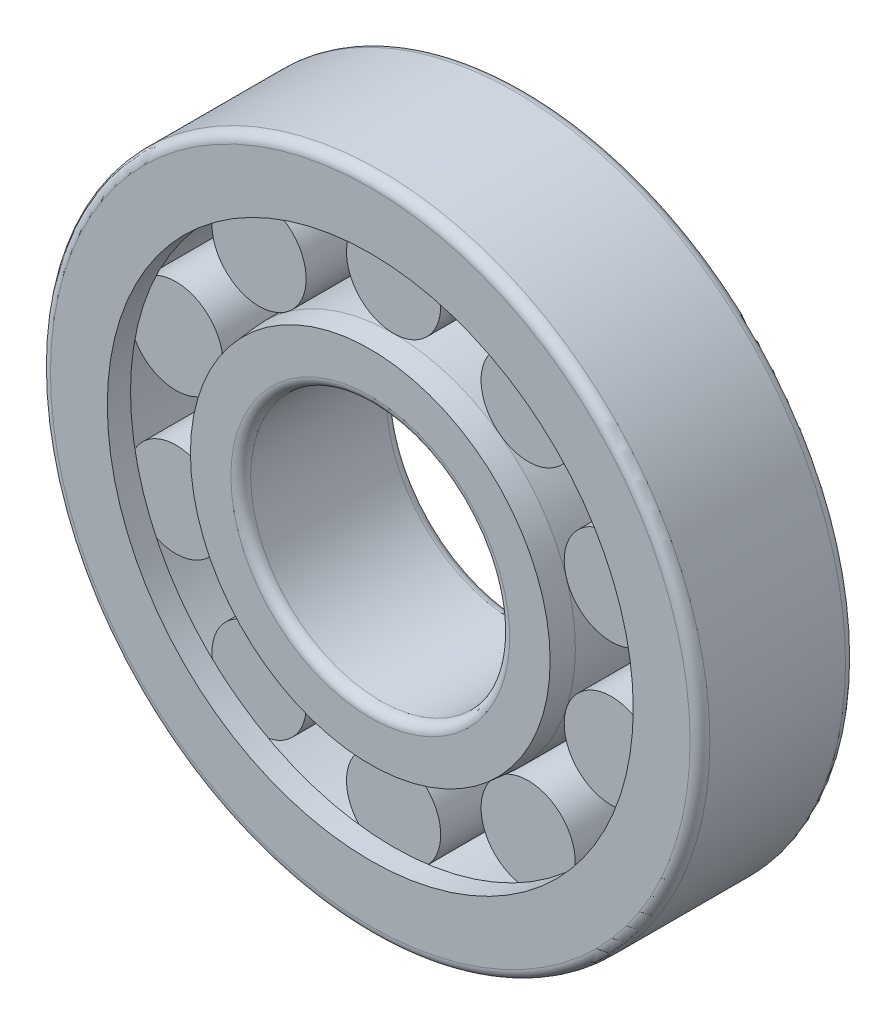
from build123d import *

# Parameters (mm, degrees)
BASESKE_W            = 23.1
BASESKE_H            = 10
FILLET1_R            = 2.1
CIRPATTERNBALL_COUNT = 10


with BuildPart() as part:
    # BaseSke → Roller (revolve)
    with BuildSketch(Plane(origin=(0, 0, 0), x_dir=(0, 0, -1), z_dir=(1, 0, 0))):
        with Locations((0, 43.6)):
            Rectangle(BASESKE_W, BASESKE_H)
    roller = revolve(axis=Axis((0, 48.6, 11.55), (0, 0, -1)))

    # OuterRaceSke → OuterRace (revolve)
    with BuildSketch(Plane(origin=(0, 0, 0), x_dir=(0, 0, -1), z_dir=(1, 0, 0))):
        Polygon((-16.5, 70), (16.5, 70), (16.5, 55.833333333), (11.575, 55.833333333), (11.575, 58.58), (-11.575, 58.58), (-11.575, 55.833333333), (-16.5, 55.833333333), align=None)
    revolve(axis=Axis((0, 0, 50.391616343), (0, 0, -1)))

    # InnerRaceSke → InnerRace (revolve)
    with BuildSketch(Plane(origin=(0, 0, 0), x_dir=(0, 0, -1), z_dir=(1, 0, 0))):
        Polygon((-16.5, 27.5), (16.5, 27.5), (16.5, 41.666666667), (11.575, 41.666666667), (11.575, 38.62), (-11.575, 38.62), (-11.575, 41.666666667), (-16.5, 41.666666667), align=None)
    revolve(axis=Axis((0, 0, 70.862590906), (0, 0, -1)))

    # Fillet1
    fillet1_edges = [part.edges().sort_by_distance(p)[0] for p in [
        (0, -27.5, 16.5),
        (0, -70, -16.5),
        (0, -70, 16.5),
        (0, -27.5, -16.5),
    ]]
    fillet(fillet1_edges, radius=FILLET1_R)

    # NJSke → NJ (revolve, cut)
    with BuildSketch(Plane(origin=(0, 0, 0), x_dir=(0, 0, -1), z_dir=(1, 0, 0))):
        Polygon((16.5, 41.666666667), (11.575, 41.666666667), (11.575, 38.62), (16.5, 38.189118332), align=None)
    nj = revolve(axis=Axis((0, 0, 35.607790457), (0, 0, -1)), mode=Mode.SUBTRACT)

    # NU: NJ across plane
    add(nj.mirror(Plane.XY), mode=Mode.SUBTRACT)

    # CirPatternBall: Roller ×10 about axis
    cirpatternball_axis = Axis((0, 0, 50.391616343), (0, 0, -1))
    for i in range(1, CIRPATTERNBALL_COUNT):
        add(roller.rotate(cirpatternball_axis, i * 360 / CIRPATTERNBALL_COUNT))


solid = part.part
